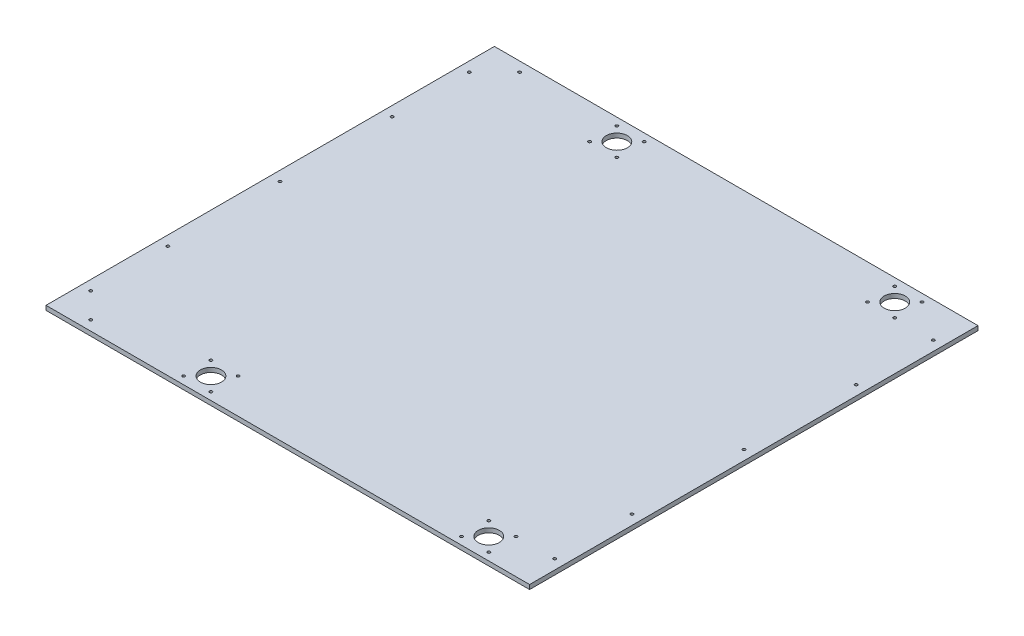
from build123d import *

# Parameters (mm, degrees)
SKETCH1_W                      = 510
SKETCH1_H                      = 5
BOSS_EXTRUDE1_DEPTH            = 550
BOTTHOMHOLES_SKETCH2_R         = 12
BOTTHOMHOLES_SKETCH2_R_2       = 1.5875
BOTTOMHOLES_CUT_EXTRUDE1_DEPTH = 751.083328704


with BuildPart() as part:
    # Sketch1 → Boss-Extrude1 (new body)
    with BuildSketch(Plane(origin=(0, 0, 0), x_dir=(0, 0, -1), z_dir=(1, 0, 0))):
        with Locations((-255, 2.5)):
            Rectangle(SKETCH1_W, SKETCH1_H)
    extrude(amount=BOSS_EXTRUDE1_DEPTH)

    # BotthomHoles-Sketch2 → BottomHoles-Cut-Extrude1 (cut, through all)
    with BuildSketch(Plane(origin=(0, 5, 0), x_dir=(1, 0, 0), z_dir=(0, 1, 0))):
        with Locations((479.425, -24.175)):
            Circle(BOTTHOMHOLES_SKETCH2_R)
        with Locations((463.925, -8.675)):
            Circle(BOTTHOMHOLES_SKETCH2_R_2)
        with Locations((494.925, -8.675)):
            Circle(BOTTHOMHOLES_SKETCH2_R_2)
        with Locations((463.925, -39.675)):
            Circle(BOTTHOMHOLES_SKETCH2_R_2)
        with Locations((494.925, -39.675)):
            Circle(BOTTHOMHOLES_SKETCH2_R_2)
        with Locations((39.6875, -11.1125)):
            Circle(BOTTHOMHOLES_SKETCH2_R_2)
        with Locations((178.925, -39.675)):
            Circle(BOTTHOMHOLES_SKETCH2_R_2)
        with Locations((147.925, -39.675)):
            Circle(BOTTHOMHOLES_SKETCH2_R_2)
        with Locations((178.925, -8.675)):
            Circle(BOTTHOMHOLES_SKETCH2_R_2)
        with Locations((147.925, -8.675)):
            Circle(BOTTHOMHOLES_SKETCH2_R_2)
        with Locations((163.425, -24.175)):
            Circle(BOTTHOMHOLES_SKETCH2_R)
        with Locations((39.6875, -498.8875)):
            Circle(BOTTHOMHOLES_SKETCH2_R_2)
        with Locations((147.925, -501.325)):
            Circle(BOTTHOMHOLES_SKETCH2_R_2)
        with Locations((178.925, -501.325)):
            Circle(BOTTHOMHOLES_SKETCH2_R_2)
        with Locations((147.925, -470.325)):
            Circle(BOTTHOMHOLES_SKETCH2_R_2)
        with Locations((178.925, -470.325)):
            Circle(BOTTHOMHOLES_SKETCH2_R_2)
        with Locations((463.925, -470.325)):
            Circle(BOTTHOMHOLES_SKETCH2_R_2)
        with Locations((463.925, -501.325)):
            Circle(BOTTHOMHOLES_SKETCH2_R_2)
        with Locations((494.925, -470.325)):
            Circle(BOTTHOMHOLES_SKETCH2_R_2)
        with Locations((494.925, -501.325)):
            Circle(BOTTHOMHOLES_SKETCH2_R_2)
        with Locations((163.425, -485.825)):
            Circle(BOTTHOMHOLES_SKETCH2_R)
        with Locations((479.425, -485.825)):
            Circle(BOTTHOMHOLES_SKETCH2_R)
        with Locations((11.1125, -39.6875)):
            Circle(BOTTHOMHOLES_SKETCH2_R_2)
        with Locations((11.1125, -127.5)):
            Circle(BOTTHOMHOLES_SKETCH2_R_2)
        with Locations((11.1125, -255)):
            Circle(BOTTHOMHOLES_SKETCH2_R_2)
        with Locations((11.1125, -382.5)):
            Circle(BOTTHOMHOLES_SKETCH2_R_2)
        with Locations((11.1125, -470.3125)):
            Circle(BOTTHOMHOLES_SKETCH2_R_2)
        with Locations((538.8875, -470.3125)):
            Circle(BOTTHOMHOLES_SKETCH2_R_2)
        with Locations((538.8875, -382.5)):
            Circle(BOTTHOMHOLES_SKETCH2_R_2)
        with Locations((538.8875, -255)):
            Circle(BOTTHOMHOLES_SKETCH2_R_2)
        with Locations((538.8875, -127.5)):
            Circle(BOTTHOMHOLES_SKETCH2_R_2)
        with Locations((538.8875, -39.6875)):
            Circle(BOTTHOMHOLES_SKETCH2_R_2)
    extrude(amount=-BOTTOMHOLES_CUT_EXTRUDE1_DEPTH, mode=Mode.SUBTRACT)


solid = part.part
